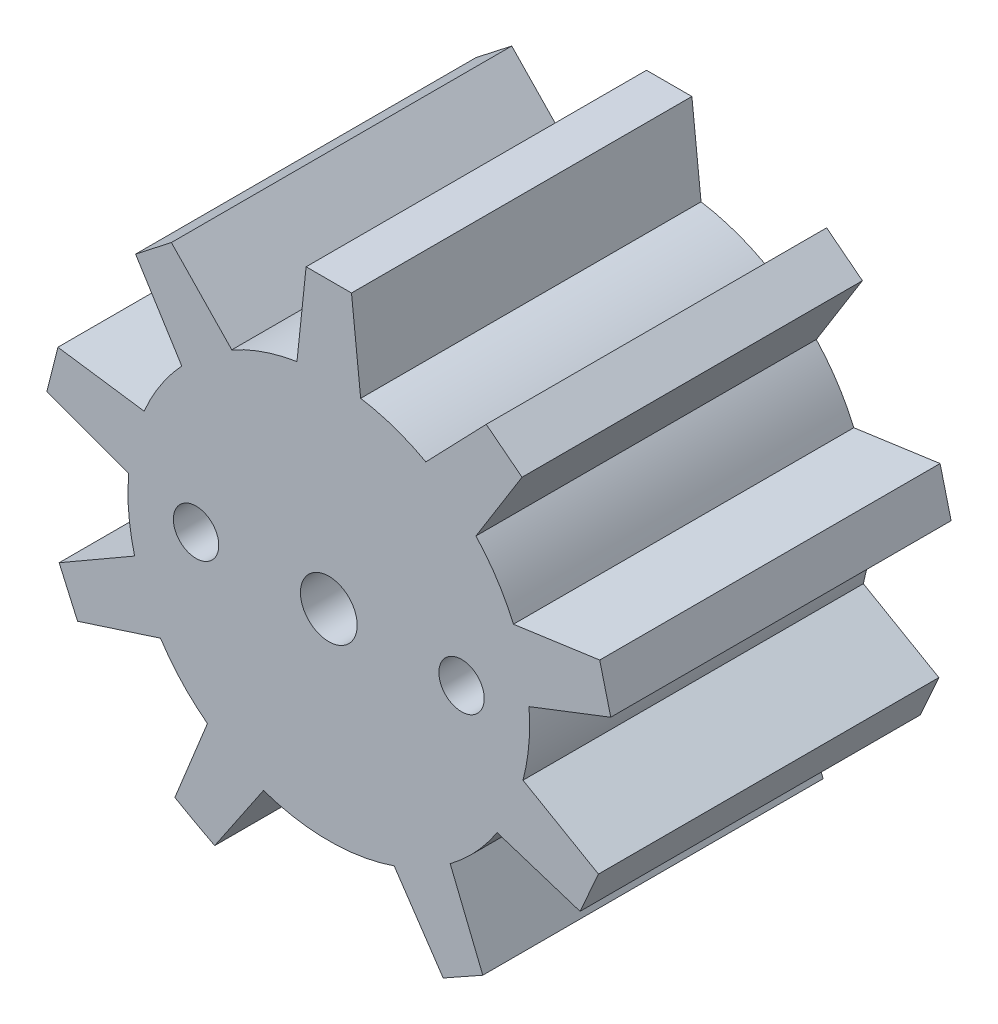
from build123d import *

# Parameters (mm, degrees)
EXTRUDE_2_DEPTH     = 15
SKETCH_5_R          = 1.25
CUT_EXTRUDE_1_DEPTH = 15
SKETCH_6_R          = 1
CUT_EXTRUDE_2_DEPTH = 29


with BuildPart() as part:
    # Эскиз3 → Бобышка-Вытянуть2 (new body)
    with BuildSketch(Plane.XY):
        with BuildLine():
            Line((-1, 12.556672608), (0, 12.556672608))
            Line((0, 12.556672608), (1, 12.556672608))
            Line((1, 12.556672608), (1.403768611, 8.737959355))
            ThreePointArc((1.403768611, 8.737959355), (2.882480289, 8.367425374), (4.275666751, 7.748623996))
            Line((4.275666751, 7.748623996), (6.938281237, 10.513338217))
            Line((6.938281237, 10.513338217), (8.514814211, 9.282670194))
            Line((8.514814211, 9.282670194), (6.483307331, 6.024053955))
            ThreePointArc((6.483307331, 6.024053955), (7.419229042, 4.824680344), (8.135910959, 3.482736406))
            Line((8.135910959, 3.482736406), (11.938429132, 4.017951822))
            Line((11.938429132, 4.017951822), (12.423885361, 2.077763107))
            Line((12.423885361, 2.077763107), (8.823580607, 0.683319303))
            ThreePointArc((8.823580607, 0.683319303), (8.813761391, -0.800068834), (8.556312106, -2.260978362))
            Line((8.556312106, -2.260978362), (11.88304599, -4.178904758))
            Line((11.88304599, -4.178904758), (11.071850771, -6.007008197))
            Line((11.071850771, -6.007008197), (7.417581711, -4.827212608))
            ThreePointArc((7.417581711, -4.827212608), (6.479864305, -6.027757343), (5.350154649, -7.049705329))
            Line((5.350154649, -7.049705329), (6.785807353, -10.588258594))
            Line((6.785807353, -10.588258594), (5.913418577, -11.077071262))
            Line((5.913418577, -11.077071262), (5.041029802, -11.565883931))
            Line((5.041029802, -11.565883931), (2.88053291, -8.36809597))
            ThreePointArc((2.88053291, -8.36809597), (0.000835422, -8.849999961), (-2.878952996, -8.368639653))
            Line((-2.878952996, -8.368639653), (-5.029072142, -11.548959277))
            Line((-5.029072142, -11.548959277), (-5.911327166, -11.078187493))
            Line((-5.911327166, -11.078187493), (-6.783800352, -10.589525504))
            Line((-6.783800352, -10.589525504), (-5.348823599, -7.050715291))
            ThreePointArc((-5.348823599, -7.050715291), (-6.479295244, -6.028369028), (-7.417581672, -4.827212668))
            Line((-7.417581672, -4.827212668), (-11.071850724, -6.007008285))
            Line((-11.071850724, -6.007008285), (-11.883045968, -4.178904821))
            Line((-11.883045968, -4.178904821), (-8.556312093, -2.260978407))
            ThreePointArc((-8.556312093, -2.260978407), (-8.817386806, -0.759071749), (-8.816843455, 0.765357101))
            Line((-8.816843455, 0.765357101), (-12.423885379, 2.077762999))
            Line((-12.423885379, 2.077762999), (-11.938429167, 4.017951718))
            Line((-11.938429167, 4.017951718), (-8.138356697, 3.477017439))
            ThreePointArc((-8.138356697, 3.477017439), (-7.419229073, 4.824680297), (-6.479071962, 6.028609003))
            Line((-6.479071962, 6.028609003), (-8.514814242, 9.282670165))
            Line((-8.514814242, 9.282670165), (-6.938281272, 10.513338193))
            Line((-6.938281272, 10.513338193), (-4.275666751, 7.748623996))
            ThreePointArc((-4.275666751, 7.748623996), (-2.882480289, 8.367425373), (-1.403768611, 8.737959355))
            Line((-1.403768611, 8.737959355), (-1, 12.556672608))
        make_face()
    extrude(amount=EXTRUDE_2_DEPTH)

    # Эскиз5 → Вырез-Вытянуть1 (cut)
    with BuildSketch(Plane(origin=(0, 0, 0), x_dir=(-1, 0, 0), z_dir=(0, 0, -1))):
        Circle(SKETCH_5_R)
    extrude(amount=-CUT_EXTRUDE_1_DEPTH, mode=Mode.SUBTRACT)

    # Эскиз6 → Вырез-Вытянуть2 (cut)
    with BuildSketch(Plane(origin=(0, 0, 0), x_dir=(-1, 0, 0), z_dir=(0, 0, -1))):
        with Locations((5.85, 0)):
            Circle(SKETCH_6_R)
        with Locations((-5.85, 0)):
            Circle(SKETCH_6_R)
    extrude(amount=-CUT_EXTRUDE_2_DEPTH, mode=Mode.SUBTRACT)


solid = part.part
